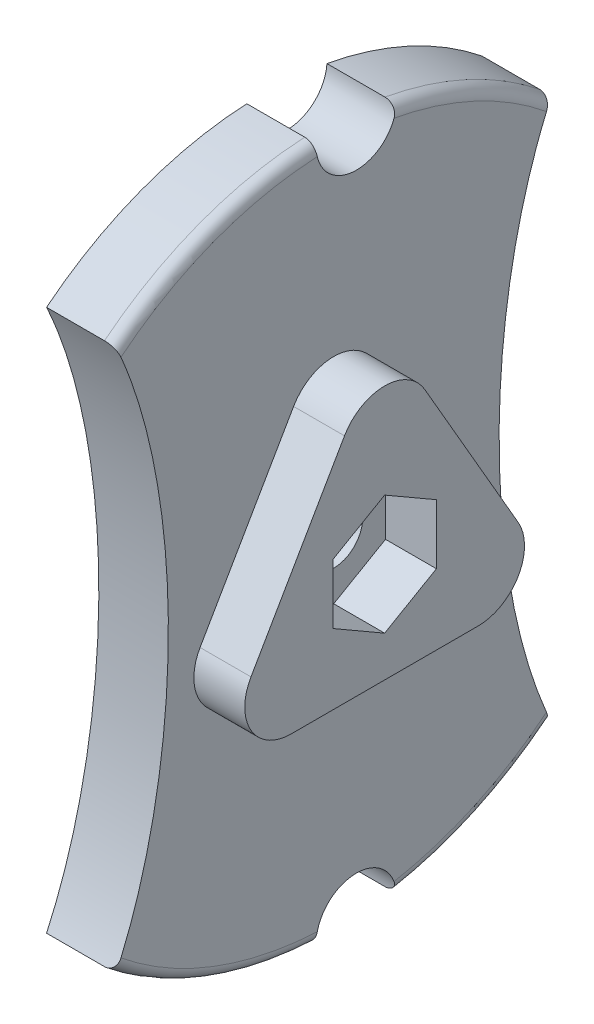
from build123d import *

# Parameters (mm, degrees)
SKETCH2_R           = 3.175
BOSS_EXTRUDE1_DEPTH = 7.62
BOSS_EXTRUDE2_DEPTH = 5.58
FILLET1_R           = 5.08
FILLET3_R           = 1.27
SKETCH4_RX          = 42.376376882
SKETCH4_RY          = 19.974607039
CUT_EXTRUDE1_DEPTH  = 56.442165398


with BuildPart() as part:
    # Sketch2 → Boss-Extrude1 (new body)
    with BuildSketch(Plane(origin=(0, 0, 0), x_dir=(0, 0, -1), z_dir=(1, 0, 0))):
        with BuildLine():
            ThreePointArc((6.877601517, -37.474105691), (38.1, 0), (6.877601517, 37.474105691))
            ThreePointArc((6.877601517, 37.474105691), (2.197519386, 33.372298724), (-1.904287581, 38.052380856))
            ThreePointArc((-1.904287581, 38.052380856), (-38.1, 0), (-1.904287581, -38.052380856))
            ThreePointArc((-1.904287581, -38.052380856), (2.197519386, -33.372298724), (6.877601517, -37.474105691))
        make_face()
        Circle(SKETCH2_R, mode=Mode.SUBTRACT)
    extrude(amount=BOSS_EXTRUDE1_DEPTH)

    # Sketch3 → Boss-Extrude2 (add)
    with BuildSketch(Plane(origin=(7.62, 0, 0), x_dir=(0, 0, -1), z_dir=(1, 0, 0))):
        Polygon((19.05, -10.998522628), (0, 21.997045256), (-19.05, -10.998522628), align=None)
        Polygon((-5.675, 3.276462778), (-5.675, -3.276462778), (0, -6.552925555), (5.675, -3.276462778), (5.675, 3.276462778), (0, 6.552925555), align=None, mode=Mode.SUBTRACT)
    extrude(amount=BOSS_EXTRUDE2_DEPTH)

    # Fillet1
    fillet1_edges = [part.edges().sort_by_distance(p)[0] for p in [
        (10.41, -10.998522628, -19.05),
        (10.41, 21.997045256, 0),
        (10.41, -10.998522628, 19.05),
    ]]
    fillet(fillet1_edges, radius=FILLET1_R)

    # Fillet3
    fillet3_edges = [part.edges().sort_by_distance(p)[0] for p in [
        (7.62, 0, -38.1),
        (7.62, 0, 38.1),
    ]]
    fillet(fillet3_edges, radius=FILLET3_R)

    # Sketch4 → Cut-Extrude1 (cut, through all)
    with BuildSketch(Plane.ZY):
        with Locations(Location((-38.1, 0), (0, 0, -90))):
            Ellipse(SKETCH4_RX, SKETCH4_RY)
    cut_extrude1 = extrude(amount=-CUT_EXTRUDE1_DEPTH, mode=Mode.SUBTRACT)

    # Mirror1: Cut-Extrude1 across plane
    add(cut_extrude1.mirror(Plane.XY), mode=Mode.SUBTRACT)


solid = part.part
